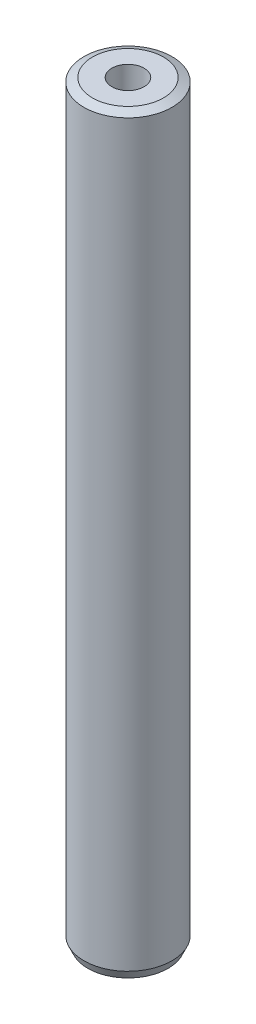
from build123d import *
from OCP.BRepFilletAPI import BRepFilletAPI_MakeChamfer

# Parameters (mm, degrees)
SKETCH1_R           = 15
BOSS_EXTRUDE1_DEPTH = 256.022970797
SKETCH2_R           = 5.4930198
CUT_EXTRUDE1_DEPTH  = 257.900295009
CHAMFER1_SIZE       = 1.320671178
CHAMFER1_SIZE2      = 2.913562761


with BuildPart() as part:
    # Sketch1 → Boss-Extrude1 (new body)
    with BuildSketch(Plane(origin=(0, 0, 0), x_dir=(1, 0, 0), z_dir=(0, 1, 0))):
        Circle(SKETCH1_R)
    extrude(amount=BOSS_EXTRUDE1_DEPTH)

    # Sketch2 → Cut-Extrude1 (cut, through all)
    with BuildSketch(Plane(origin=(0, 0, 0), x_dir=(1, 0, 0), z_dir=(0, 1, 0))):
        Circle(SKETCH2_R)
    extrude(amount=CUT_EXTRUDE1_DEPTH, mode=Mode.SUBTRACT)

    # Chamfer1: one chamfer whose edges measure the first distance from different faces: ONE call of the kernel's chamfer builder (chamfer() names one face for all edges)
    chamfer1_edges_1 = [part.edges().sort_by_distance(p)[0] for p in [
        (-15, 256.022970797, 0),
    ]]
    chamfer1_side_1 = [part.faces().sort_by_distance(p)[0] for p in [
        (-15, 128.011485398, 0),
    ]]
    chamfer1_edges_2 = [part.edges().sort_by_distance(p)[0] for p in [
        (-15, 0, 0),
    ]]
    chamfer1_side_2 = [part.faces().sort_by_distance(p)[0] for p in [
        (-14.575735931, 0, 0),
    ]]
    chamfer1 = BRepFilletAPI_MakeChamfer(part.part.solid().wrapped)
    for e in chamfer1_edges_1:
        chamfer1.Add(CHAMFER1_SIZE, CHAMFER1_SIZE2, e.wrapped, chamfer1_side_1[0].wrapped)  # the first distance lies on this face
    for e in chamfer1_edges_2:
        chamfer1.Add(CHAMFER1_SIZE, CHAMFER1_SIZE2, e.wrapped, chamfer1_side_2[0].wrapped)  # the first distance lies on this face
    add(Compound.cast(chamfer1.Shape()), mode=Mode.REPLACE)


solid = part.part
